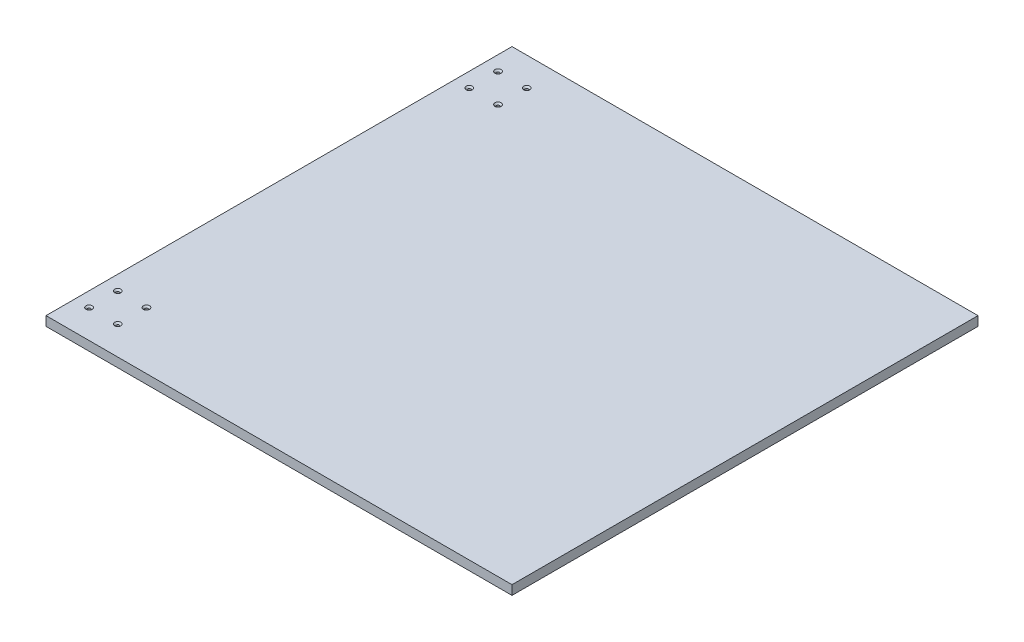
from build123d import *

# Parameters (mm, degrees)
SZKIC1_W                                             = 500
SZKIC1_H                                             = 500
DODANIE_WYCI_GNI_CIE1_DEPTH                          = 10
POG_BIENIE_STO_KOWE_POD_M3_WKR_T_USTALAJ_D           = 3.4
POG_BIENIE_STO_KOWE_POD_M3_WKR_T_USTALAJ_DEPTH       = 10
POG_BIENIE_STO_KOWE_POD_M3_WKR_T_USTALAJ_CSINK_D     = 6.72
POG_BIENIE_STO_KOWE_POD_M3_WKR_T_USTALAJ_CSINK_ANGLE = 90
POG_BIENIE_STO_KOWE_POD_M3_WKR_T_USTALAJ_TIP         = 1.021463052


with BuildPart() as part:
    # Szkic1 → Dodanie-wyciągnięcie1 (new body)
    with BuildSketch(Plane(origin=(0, 0, 0), x_dir=(1, 0, 0), z_dir=(0, 1, 0))):
        with Locations((250, 250)):
            Rectangle(SZKIC1_W, SZKIC1_H)
    extrude(amount=DODANIE_WYCI_GNI_CIE1_DEPTH)

    # Pogłębienie stożkowe pod M3 Wkręt ustalający1
    with Locations(Plane(origin=(0, 10, 0), x_dir=(1, 0, 0), z_dir=(0, 1, 0))):
        with Locations((46.4, 30.6), (46.4, 61.4), (15.6, 61.4), (15.6, 30.6), (46.4, 438.6), (46.4, 469.4), (15.6, 469.4), (15.6, 438.6)):
            CounterSinkHole(POG_BIENIE_STO_KOWE_POD_M3_WKR_T_USTALAJ_D / 2, POG_BIENIE_STO_KOWE_POD_M3_WKR_T_USTALAJ_CSINK_D / 2, depth=POG_BIENIE_STO_KOWE_POD_M3_WKR_T_USTALAJ_DEPTH, counter_sink_angle=POG_BIENIE_STO_KOWE_POD_M3_WKR_T_USTALAJ_CSINK_ANGLE)
            with Locations((0, 0, -(POG_BIENIE_STO_KOWE_POD_M3_WKR_T_USTALAJ_DEPTH + POG_BIENIE_STO_KOWE_POD_M3_WKR_T_USTALAJ_TIP / 2))):  # 118° drill point
                Cone(0, POG_BIENIE_STO_KOWE_POD_M3_WKR_T_USTALAJ_D / 2, POG_BIENIE_STO_KOWE_POD_M3_WKR_T_USTALAJ_TIP, mode=Mode.SUBTRACT)


solid = part.part
